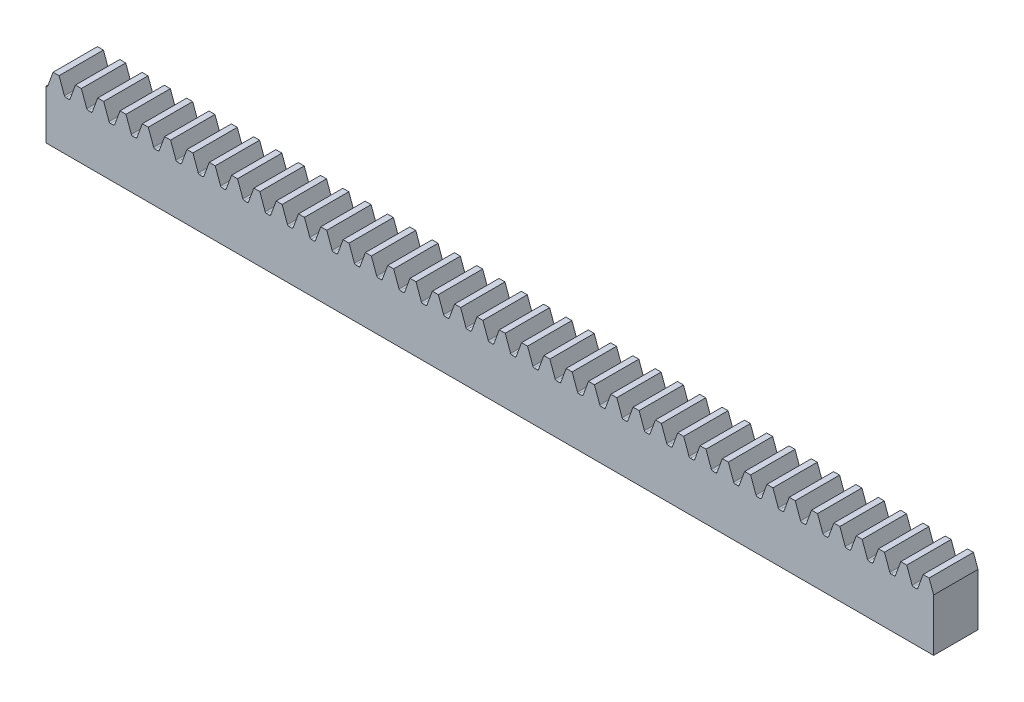
from build123d import *

# Parameters (mm, degrees)
BOSS_EXTRUDE1_DEPTH      = 125
BOSS_EXTRUDE1_DEPTH_BACK = 125
SKETCH3_W                = 5
SKETCH3_H                = 7.3
CUT_EXTRUDE1_DEPTH       = 126.078265498
FILLET1_R                = 0.167343945
LPATTERN1_START          = -2.5
LPATTERN1_DEPTH          = 5
SKETCH7_W                = 5
SKETCH7_H                = 7.3
CUT_EXTRUDE2_DEPTH       = 150


# Read off the part's stored shape, not the designer's step: LPattern1
with BuildPart() as part:
    # Sketch3 → Boss-Extrude1 (new, two sides: drawn at the far end of the back side and taken through both)
    with BuildSketch(Plane(origin=(0, 0, 0), x_dir=(0, 0, -1), z_dir=(1, 0, 0)).offset(-BOSS_EXTRUDE1_DEPTH_BACK)):
        Rectangle(SKETCH3_W, SKETCH3_H)
    extrude(amount=BOSS_EXTRUDE1_DEPTH + BOSS_EXTRUDE1_DEPTH_BACK)

    # Sketch4 → Cut-Extrude1 (cut, symmetric)
    with BuildSketch(Plane.XY):
        Polygon((-124.325716375, 3.65), (-123.685128763, 1.89), (-123.127315612, 1.89), (-122.486728, 3.65), align=None)
    extrude(amount=CUT_EXTRUDE1_DEPTH, both=True, mode=Mode.SUBTRACT)

    # Fillet1
    fillet1_edges = [part.edges().sort_by_distance(p)[0] for p in [
        (-123.127315612, 1.89, 0),
        (-123.685128763, 1.89, 0),
    ]]
    fillet(fillet1_edges, radius=FILLET1_R)

    # LPattern1 outline → LPattern1 (cut)
    with BuildSketch(Plane.XY.offset(LPATTERN1_START)):
        with BuildLine():
            ThreePointArc((-121.211933141, 2.000108945), (-121.150665815, 1.92026381), (-121.054681271, 1.89))
            Line((-121.054681271, 1.89), (-120.731219104, 1.89))
            ThreePointArc((-120.731219104, 1.89), (-120.63523456, 1.92026381), (-120.573967234, 2.000108945))
            Line((-120.573967234, 2.000108945), (-119.973456, 3.65))
            Line((-119.973456, 3.65), (-121.812444375, 3.65))
            Line((-121.812444375, 3.65), (-121.211933141, 2.000108945))
        make_face()
        Polygon((125, 3.65), (124.488211625, 3.65), (125, 2.243872997), align=None)
        with BuildLine():
            Line((123.813928, 3.65), (121.974939625, 3.65))
            Line((121.974939625, 3.65), (122.575450859, 2.000108945))
            ThreePointArc((122.575450859, 2.000108945), (122.636718185, 1.92026381), (122.732702729, 1.89))
            Line((122.732702729, 1.89), (123.056164896, 1.89))
            ThreePointArc((123.056164896, 1.89), (123.15214944, 1.92026381), (123.213416766, 2.000108945))
            Line((123.213416766, 2.000108945), (123.813928, 3.65))
        make_face()
        with BuildLine():
            Line((121.300656, 3.65), (119.461667625, 3.65))
            Line((119.461667625, 3.65), (120.062178859, 2.000108945))
            ThreePointArc((120.062178859, 2.000108945), (120.123446185, 1.92026381), (120.219430729, 1.89))
            Line((120.219430729, 1.89), (120.542892896, 1.89))
            ThreePointArc((120.542892896, 1.89), (120.63887744, 1.92026381), (120.700144766, 2.000108945))
            Line((120.700144766, 2.000108945), (121.300656, 3.65))
        make_face()
        with BuildLine():
            Line((118.787384, 3.65), (116.948395625, 3.65))
            Line((116.948395625, 3.65), (117.548906859, 2.000108945))
            ThreePointArc((117.548906859, 2.000108945), (117.610174185, 1.92026381), (117.706158729, 1.89))
            Line((117.706158729, 1.89), (118.029620896, 1.89))
            ThreePointArc((118.029620896, 1.89), (118.12560544, 1.92026381), (118.186872766, 2.000108945))
            Line((118.186872766, 2.000108945), (118.787384, 3.65))
        make_face()
        with BuildLine():
            Line((116.274112, 3.65), (114.435123625, 3.65))
            Line((114.435123625, 3.65), (115.035634859, 2.000108945))
            ThreePointArc((115.035634859, 2.000108945), (115.096902185, 1.92026381), (115.192886729, 1.89))
            Line((115.192886729, 1.89), (115.516348896, 1.89))
            ThreePointArc((115.516348896, 1.89), (115.61233344, 1.92026381), (115.673600766, 2.000108945))
            Line((115.673600766, 2.000108945), (116.274112, 3.65))
        make_face()
        with BuildLine():
            Line((113.76084, 3.65), (111.921851625, 3.65))
            Line((111.921851625, 3.65), (112.522362859, 2.000108945))
            ThreePointArc((112.522362859, 2.000108945), (112.583630185, 1.92026381), (112.679614729, 1.89))
            Line((112.679614729, 1.89), (113.003076896, 1.89))
            ThreePointArc((113.003076896, 1.89), (113.09906144, 1.92026381), (113.160328766, 2.000108945))
            Line((113.160328766, 2.000108945), (113.76084, 3.65))
        make_face()
        with BuildLine():
            Line((111.247568, 3.65), (109.408579625, 3.65))
            Line((109.408579625, 3.65), (110.009090859, 2.000108945))
            ThreePointArc((110.009090859, 2.000108945), (110.070358185, 1.92026381), (110.166342729, 1.89))
            Line((110.166342729, 1.89), (110.489804896, 1.89))
            ThreePointArc((110.489804896, 1.89), (110.58578944, 1.92026381), (110.647056766, 2.000108945))
            Line((110.647056766, 2.000108945), (111.247568, 3.65))
        make_face()
        with BuildLine():
            Line((108.734296, 3.65), (106.895307625, 3.65))
            Line((106.895307625, 3.65), (107.495818859, 2.000108945))
            ThreePointArc((107.495818859, 2.000108945), (107.557086185, 1.92026381), (107.653070729, 1.89))
            Line((107.653070729, 1.89), (107.976532896, 1.89))
            ThreePointArc((107.976532896, 1.89), (108.07251744, 1.92026381), (108.133784766, 2.000108945))
            Line((108.133784766, 2.000108945), (108.734296, 3.65))
        make_face()
        with BuildLine():
            Line((106.221024, 3.65), (104.382035625, 3.65))
            Line((104.382035625, 3.65), (104.982546859, 2.000108945))
            ThreePointArc((104.982546859, 2.000108945), (105.043814185, 1.92026381), (105.139798729, 1.89))
            Line((105.139798729, 1.89), (105.463260896, 1.89))
            ThreePointArc((105.463260896, 1.89), (105.55924544, 1.92026381), (105.620512766, 2.000108945))
            Line((105.620512766, 2.000108945), (106.221024, 3.65))
        make_face()
        with BuildLine():
            Line((103.707752, 3.65), (101.868763625, 3.65))
            Line((101.868763625, 3.65), (102.469274859, 2.000108945))
            ThreePointArc((102.469274859, 2.000108945), (102.530542185, 1.92026381), (102.626526729, 1.89))
            Line((102.626526729, 1.89), (102.949988896, 1.89))
            ThreePointArc((102.949988896, 1.89), (103.04597344, 1.92026381), (103.107240766, 2.000108945))
            Line((103.107240766, 2.000108945), (103.707752, 3.65))
        make_face()
        with BuildLine():
            Line((101.19448, 3.65), (99.355491625, 3.65))
            Line((99.355491625, 3.65), (99.956002859, 2.000108945))
            ThreePointArc((99.956002859, 2.000108945), (100.017270185, 1.92026381), (100.113254729, 1.89))
            Line((100.113254729, 1.89), (100.436716896, 1.89))
            ThreePointArc((100.436716896, 1.89), (100.53270144, 1.92026381), (100.593968766, 2.000108945))
            Line((100.593968766, 2.000108945), (101.19448, 3.65))
        make_face()
        with BuildLine():
            Line((98.681208, 3.65), (96.842219625, 3.65))
            Line((96.842219625, 3.65), (97.442730859, 2.000108945))
            ThreePointArc((97.442730859, 2.000108945), (97.503998185, 1.92026381), (97.599982729, 1.89))
            Line((97.599982729, 1.89), (97.923444896, 1.89))
            ThreePointArc((97.923444896, 1.89), (98.01942944, 1.92026381), (98.080696766, 2.000108945))
            Line((98.080696766, 2.000108945), (98.681208, 3.65))
        make_face()
        with BuildLine():
            Line((96.167936, 3.65), (94.328947625, 3.65))
            Line((94.328947625, 3.65), (94.929458859, 2.000108945))
            ThreePointArc((94.929458859, 2.000108945), (94.990726185, 1.92026381), (95.086710729, 1.89))
            Line((95.086710729, 1.89), (95.410172896, 1.89))
            ThreePointArc((95.410172896, 1.89), (95.50615744, 1.92026381), (95.567424766, 2.000108945))
            Line((95.567424766, 2.000108945), (96.167936, 3.65))
        make_face()
        with BuildLine():
            Line((93.654664, 3.65), (91.815675625, 3.65))
            Line((91.815675625, 3.65), (92.416186859, 2.000108945))
            ThreePointArc((92.416186859, 2.000108945), (92.477454185, 1.92026381), (92.573438729, 1.89))
            Line((92.573438729, 1.89), (92.896900896, 1.89))
            ThreePointArc((92.896900896, 1.89), (92.99288544, 1.92026381), (93.054152766, 2.000108945))
            Line((93.054152766, 2.000108945), (93.654664, 3.65))
        make_face()
        with BuildLine():
            Line((91.141392, 3.65), (89.302403625, 3.65))
            Line((89.302403625, 3.65), (89.902914859, 2.000108945))
            ThreePointArc((89.902914859, 2.000108945), (89.964182185, 1.92026381), (90.060166729, 1.89))
            Line((90.060166729, 1.89), (90.383628896, 1.89))
            ThreePointArc((90.383628896, 1.89), (90.47961344, 1.92026381), (90.540880766, 2.000108945))
            Line((90.540880766, 2.000108945), (91.141392, 3.65))
        make_face()
        with BuildLine():
            Line((88.62812, 3.65), (86.789131625, 3.65))
            Line((86.789131625, 3.65), (87.389642859, 2.000108945))
            ThreePointArc((87.389642859, 2.000108945), (87.450910185, 1.92026381), (87.546894729, 1.89))
            Line((87.546894729, 1.89), (87.870356896, 1.89))
            ThreePointArc((87.870356896, 1.89), (87.96634144, 1.92026381), (88.027608766, 2.000108945))
            Line((88.027608766, 2.000108945), (88.62812, 3.65))
        make_face()
        with BuildLine():
            Line((86.114848, 3.65), (84.275859625, 3.65))
            Line((84.275859625, 3.65), (84.876370859, 2.000108945))
            ThreePointArc((84.876370859, 2.000108945), (84.937638185, 1.92026381), (85.033622729, 1.89))
            Line((85.033622729, 1.89), (85.357084896, 1.89))
            ThreePointArc((85.357084896, 1.89), (85.45306944, 1.92026381), (85.514336766, 2.000108945))
            Line((85.514336766, 2.000108945), (86.114848, 3.65))
        make_face()
        with BuildLine():
            Line((83.601576, 3.65), (81.762587625, 3.65))
            Line((81.762587625, 3.65), (82.363098859, 2.000108945))
            ThreePointArc((82.363098859, 2.000108945), (82.424366185, 1.92026381), (82.520350729, 1.89))
            Line((82.520350729, 1.89), (82.843812896, 1.89))
            ThreePointArc((82.843812896, 1.89), (82.93979744, 1.92026381), (83.001064766, 2.000108945))
            Line((83.001064766, 2.000108945), (83.601576, 3.65))
        make_face()
        with BuildLine():
            Line((81.088304, 3.65), (79.249315625, 3.65))
            Line((79.249315625, 3.65), (79.849826859, 2.000108945))
            ThreePointArc((79.849826859, 2.000108945), (79.911094185, 1.92026381), (80.007078729, 1.89))
            Line((80.007078729, 1.89), (80.330540896, 1.89))
            ThreePointArc((80.330540896, 1.89), (80.42652544, 1.92026381), (80.487792766, 2.000108945))
            Line((80.487792766, 2.000108945), (81.088304, 3.65))
        make_face()
        with BuildLine():
            Line((78.575032, 3.65), (76.736043625, 3.65))
            Line((76.736043625, 3.65), (77.336554859, 2.000108945))
            ThreePointArc((77.336554859, 2.000108945), (77.397822185, 1.92026381), (77.493806729, 1.89))
            Line((77.493806729, 1.89), (77.817268896, 1.89))
            ThreePointArc((77.817268896, 1.89), (77.91325344, 1.92026381), (77.974520766, 2.000108945))
            Line((77.974520766, 2.000108945), (78.575032, 3.65))
        make_face()
        with BuildLine():
            Line((76.06176, 3.65), (74.222771625, 3.65))
            Line((74.222771625, 3.65), (74.823282859, 2.000108945))
            ThreePointArc((74.823282859, 2.000108945), (74.884550185, 1.92026381), (74.980534729, 1.89))
            Line((74.980534729, 1.89), (75.303996896, 1.89))
            ThreePointArc((75.303996896, 1.89), (75.39998144, 1.92026381), (75.461248766, 2.000108945))
            Line((75.461248766, 2.000108945), (76.06176, 3.65))
        make_face()
        with BuildLine():
            Line((73.548488, 3.65), (71.709499625, 3.65))
            Line((71.709499625, 3.65), (72.310010859, 2.000108945))
            ThreePointArc((72.310010859, 2.000108945), (72.371278185, 1.92026381), (72.467262729, 1.89))
            Line((72.467262729, 1.89), (72.790724896, 1.89))
            ThreePointArc((72.790724896, 1.89), (72.88670944, 1.92026381), (72.947976766, 2.000108945))
            Line((72.947976766, 2.000108945), (73.548488, 3.65))
        make_face()
        with BuildLine():
            Line((71.035216, 3.65), (69.196227625, 3.65))
            Line((69.196227625, 3.65), (69.796738859, 2.000108945))
            ThreePointArc((69.796738859, 2.000108945), (69.858006185, 1.92026381), (69.953990729, 1.89))
            Line((69.953990729, 1.89), (70.277452896, 1.89))
            ThreePointArc((70.277452896, 1.89), (70.37343744, 1.92026381), (70.434704766, 2.000108945))
            Line((70.434704766, 2.000108945), (71.035216, 3.65))
        make_face()
        with BuildLine():
            Line((68.521944, 3.65), (66.682955625, 3.65))
            Line((66.682955625, 3.65), (67.283466859, 2.000108945))
            ThreePointArc((67.283466859, 2.000108945), (67.344734185, 1.92026381), (67.440718729, 1.89))
            Line((67.440718729, 1.89), (67.764180896, 1.89))
            ThreePointArc((67.764180896, 1.89), (67.86016544, 1.92026381), (67.921432766, 2.000108945))
            Line((67.921432766, 2.000108945), (68.521944, 3.65))
        make_face()
        with BuildLine():
            Line((66.008672, 3.65), (64.169683625, 3.65))
            Line((64.169683625, 3.65), (64.770194859, 2.000108945))
            ThreePointArc((64.770194859, 2.000108945), (64.831462185, 1.92026381), (64.927446729, 1.89))
            Line((64.927446729, 1.89), (65.250908896, 1.89))
            ThreePointArc((65.250908896, 1.89), (65.34689344, 1.92026381), (65.408160766, 2.000108945))
            Line((65.408160766, 2.000108945), (66.008672, 3.65))
        make_face()
        with BuildLine():
            Line((63.4954, 3.65), (61.656411625, 3.65))
            Line((61.656411625, 3.65), (62.256922859, 2.000108945))
            ThreePointArc((62.256922859, 2.000108945), (62.318190185, 1.92026381), (62.414174729, 1.89))
            Line((62.414174729, 1.89), (62.737636896, 1.89))
            ThreePointArc((62.737636896, 1.89), (62.83362144, 1.92026381), (62.894888766, 2.000108945))
            Line((62.894888766, 2.000108945), (63.4954, 3.65))
        make_face()
        with BuildLine():
            Line((60.982128, 3.65), (59.143139625, 3.65))
            Line((59.143139625, 3.65), (59.743650859, 2.000108945))
            ThreePointArc((59.743650859, 2.000108945), (59.804918185, 1.92026381), (59.900902729, 1.89))
            Line((59.900902729, 1.89), (60.224364896, 1.89))
            ThreePointArc((60.224364896, 1.89), (60.32034944, 1.92026381), (60.381616766, 2.000108945))
            Line((60.381616766, 2.000108945), (60.982128, 3.65))
        make_face()
        with BuildLine():
            Line((58.468856, 3.65), (56.629867625, 3.65))
            Line((56.629867625, 3.65), (57.230378859, 2.000108945))
            ThreePointArc((57.230378859, 2.000108945), (57.291646185, 1.92026381), (57.387630729, 1.89))
            Line((57.387630729, 1.89), (57.711092896, 1.89))
            ThreePointArc((57.711092896, 1.89), (57.80707744, 1.92026381), (57.868344766, 2.000108945))
            Line((57.868344766, 2.000108945), (58.468856, 3.65))
        make_face()
        with BuildLine():
            Line((55.955584, 3.65), (54.116595625, 3.65))
            Line((54.116595625, 3.65), (54.717106859, 2.000108945))
            ThreePointArc((54.717106859, 2.000108945), (54.778374185, 1.92026381), (54.874358729, 1.89))
            Line((54.874358729, 1.89), (55.197820896, 1.89))
            ThreePointArc((55.197820896, 1.89), (55.29380544, 1.92026381), (55.355072766, 2.000108945))
            Line((55.355072766, 2.000108945), (55.955584, 3.65))
        make_face()
        with BuildLine():
            Line((53.442312, 3.65), (51.603323625, 3.65))
            Line((51.603323625, 3.65), (52.203834859, 2.000108945))
            ThreePointArc((52.203834859, 2.000108945), (52.265102185, 1.92026381), (52.361086729, 1.89))
            Line((52.361086729, 1.89), (52.684548896, 1.89))
            ThreePointArc((52.684548896, 1.89), (52.78053344, 1.92026381), (52.841800766, 2.000108945))
            Line((52.841800766, 2.000108945), (53.442312, 3.65))
        make_face()
        with BuildLine():
            Line((50.92904, 3.65), (49.090051625, 3.65))
            Line((49.090051625, 3.65), (49.690562859, 2.000108945))
            ThreePointArc((49.690562859, 2.000108945), (49.751830185, 1.92026381), (49.847814729, 1.89))
            Line((49.847814729, 1.89), (50.171276896, 1.89))
            ThreePointArc((50.171276896, 1.89), (50.26726144, 1.92026381), (50.328528766, 2.000108945))
            Line((50.328528766, 2.000108945), (50.92904, 3.65))
        make_face()
        with BuildLine():
            Line((48.415768, 3.65), (46.576779625, 3.65))
            Line((46.576779625, 3.65), (47.177290859, 2.000108945))
            ThreePointArc((47.177290859, 2.000108945), (47.238558185, 1.92026381), (47.334542729, 1.89))
            Line((47.334542729, 1.89), (47.658004896, 1.89))
            ThreePointArc((47.658004896, 1.89), (47.75398944, 1.92026381), (47.815256766, 2.000108945))
            Line((47.815256766, 2.000108945), (48.415768, 3.65))
        make_face()
        with BuildLine():
            Line((45.902496, 3.65), (44.063507625, 3.65))
            Line((44.063507625, 3.65), (44.664018859, 2.000108945))
            ThreePointArc((44.664018859, 2.000108945), (44.725286185, 1.92026381), (44.821270729, 1.89))
            Line((44.821270729, 1.89), (45.144732896, 1.89))
            ThreePointArc((45.144732896, 1.89), (45.24071744, 1.92026381), (45.301984766, 2.000108945))
            Line((45.301984766, 2.000108945), (45.902496, 3.65))
        make_face()
        with BuildLine():
            Line((43.389224, 3.65), (41.550235625, 3.65))
            Line((41.550235625, 3.65), (42.150746859, 2.000108945))
            ThreePointArc((42.150746859, 2.000108945), (42.212014185, 1.92026381), (42.307998729, 1.89))
            Line((42.307998729, 1.89), (42.631460896, 1.89))
            ThreePointArc((42.631460896, 1.89), (42.72744544, 1.92026381), (42.788712766, 2.000108945))
            Line((42.788712766, 2.000108945), (43.389224, 3.65))
        make_face()
        with BuildLine():
            Line((40.875952, 3.65), (39.036963625, 3.65))
            Line((39.036963625, 3.65), (39.637474859, 2.000108945))
            ThreePointArc((39.637474859, 2.000108945), (39.698742185, 1.92026381), (39.794726729, 1.89))
            Line((39.794726729, 1.89), (40.118188896, 1.89))
            ThreePointArc((40.118188896, 1.89), (40.21417344, 1.92026381), (40.275440766, 2.000108945))
            Line((40.275440766, 2.000108945), (40.875952, 3.65))
        make_face()
        with BuildLine():
            Line((38.36268, 3.65), (36.523691625, 3.65))
            Line((36.523691625, 3.65), (37.124202859, 2.000108945))
            ThreePointArc((37.124202859, 2.000108945), (37.185470185, 1.92026381), (37.281454729, 1.89))
            Line((37.281454729, 1.89), (37.604916896, 1.89))
            ThreePointArc((37.604916896, 1.89), (37.70090144, 1.92026381), (37.762168766, 2.000108945))
            Line((37.762168766, 2.000108945), (38.36268, 3.65))
        make_face()
        with BuildLine():
            Line((35.849408, 3.65), (34.010419625, 3.65))
            Line((34.010419625, 3.65), (34.610930859, 2.000108945))
            ThreePointArc((34.610930859, 2.000108945), (34.672198185, 1.92026381), (34.768182729, 1.89))
            Line((34.768182729, 1.89), (35.091644896, 1.89))
            ThreePointArc((35.091644896, 1.89), (35.18762944, 1.92026381), (35.248896766, 2.000108945))
            Line((35.248896766, 2.000108945), (35.849408, 3.65))
        make_face()
        with BuildLine():
            Line((33.336136, 3.65), (31.497147625, 3.65))
            Line((31.497147625, 3.65), (32.097658859, 2.000108945))
            ThreePointArc((32.097658859, 2.000108945), (32.158926185, 1.92026381), (32.254910729, 1.89))
            Line((32.254910729, 1.89), (32.578372896, 1.89))
            ThreePointArc((32.578372896, 1.89), (32.67435744, 1.92026381), (32.735624766, 2.000108945))
            Line((32.735624766, 2.000108945), (33.336136, 3.65))
        make_face()
        with BuildLine():
            Line((30.822864, 3.65), (28.983875625, 3.65))
            Line((28.983875625, 3.65), (29.584386859, 2.000108945))
            ThreePointArc((29.584386859, 2.000108945), (29.645654185, 1.92026381), (29.741638729, 1.89))
            Line((29.741638729, 1.89), (30.065100896, 1.89))
            ThreePointArc((30.065100896, 1.89), (30.16108544, 1.92026381), (30.222352766, 2.000108945))
            Line((30.222352766, 2.000108945), (30.822864, 3.65))
        make_face()
        with BuildLine():
            Line((28.309592, 3.65), (26.470603625, 3.65))
            Line((26.470603625, 3.65), (27.071114859, 2.000108945))
            ThreePointArc((27.071114859, 2.000108945), (27.132382185, 1.92026381), (27.228366729, 1.89))
            Line((27.228366729, 1.89), (27.551828896, 1.89))
            ThreePointArc((27.551828896, 1.89), (27.64781344, 1.92026381), (27.709080766, 2.000108945))
            Line((27.709080766, 2.000108945), (28.309592, 3.65))
        make_face()
        with BuildLine():
            Line((25.79632, 3.65), (23.957331625, 3.65))
            Line((23.957331625, 3.65), (24.557842859, 2.000108945))
            ThreePointArc((24.557842859, 2.000108945), (24.619110185, 1.92026381), (24.715094729, 1.89))
            Line((24.715094729, 1.89), (25.038556896, 1.89))
            ThreePointArc((25.038556896, 1.89), (25.13454144, 1.92026381), (25.195808766, 2.000108945))
            Line((25.195808766, 2.000108945), (25.79632, 3.65))
        make_face()
        with BuildLine():
            Line((23.283048, 3.65), (21.444059625, 3.65))
            Line((21.444059625, 3.65), (22.044570859, 2.000108945))
            ThreePointArc((22.044570859, 2.000108945), (22.105838185, 1.92026381), (22.201822729, 1.89))
            Line((22.201822729, 1.89), (22.525284896, 1.89))
            ThreePointArc((22.525284896, 1.89), (22.62126944, 1.92026381), (22.682536766, 2.000108945))
            Line((22.682536766, 2.000108945), (23.283048, 3.65))
        make_face()
        with BuildLine():
            Line((20.769776, 3.65), (18.930787625, 3.65))
            Line((18.930787625, 3.65), (19.531298859, 2.000108945))
            ThreePointArc((19.531298859, 2.000108945), (19.592566185, 1.92026381), (19.688550729, 1.89))
            Line((19.688550729, 1.89), (20.012012896, 1.89))
            ThreePointArc((20.012012896, 1.89), (20.10799744, 1.92026381), (20.169264766, 2.000108945))
            Line((20.169264766, 2.000108945), (20.769776, 3.65))
        make_face()
        with BuildLine():
            Line((18.256504, 3.65), (16.417515625, 3.65))
            Line((16.417515625, 3.65), (17.018026859, 2.000108945))
            ThreePointArc((17.018026859, 2.000108945), (17.079294185, 1.92026381), (17.175278729, 1.89))
            Line((17.175278729, 1.89), (17.498740896, 1.89))
            ThreePointArc((17.498740896, 1.89), (17.59472544, 1.92026381), (17.655992766, 2.000108945))
            Line((17.655992766, 2.000108945), (18.256504, 3.65))
        make_face()
        with BuildLine():
            Line((15.743232, 3.65), (13.904243625, 3.65))
            Line((13.904243625, 3.65), (14.504754859, 2.000108945))
            ThreePointArc((14.504754859, 2.000108945), (14.566022185, 1.92026381), (14.662006729, 1.89))
            Line((14.662006729, 1.89), (14.985468896, 1.89))
            ThreePointArc((14.985468896, 1.89), (15.08145344, 1.92026381), (15.142720766, 2.000108945))
            Line((15.142720766, 2.000108945), (15.743232, 3.65))
        make_face()
        with BuildLine():
            Line((13.22996, 3.65), (11.390971625, 3.65))
            Line((11.390971625, 3.65), (11.991482859, 2.000108945))
            ThreePointArc((11.991482859, 2.000108945), (12.052750185, 1.92026381), (12.148734729, 1.89))
            Line((12.148734729, 1.89), (12.472196896, 1.89))
            ThreePointArc((12.472196896, 1.89), (12.56818144, 1.92026381), (12.629448766, 2.000108945))
            Line((12.629448766, 2.000108945), (13.22996, 3.65))
        make_face()
        with BuildLine():
            Line((10.716688, 3.65), (8.877699625, 3.65))
            Line((8.877699625, 3.65), (9.478210859, 2.000108945))
            ThreePointArc((9.478210859, 2.000108945), (9.539478185, 1.92026381), (9.635462729, 1.89))
            Line((9.635462729, 1.89), (9.958924896, 1.89))
            ThreePointArc((9.958924896, 1.89), (10.05490944, 1.92026381), (10.116176766, 2.000108945))
            Line((10.116176766, 2.000108945), (10.716688, 3.65))
        make_face()
        with BuildLine():
            Line((8.203416, 3.65), (6.364427625, 3.65))
            Line((6.364427625, 3.65), (6.964938859, 2.000108945))
            ThreePointArc((6.964938859, 2.000108945), (7.026206185, 1.92026381), (7.122190729, 1.89))
            Line((7.122190729, 1.89), (7.445652896, 1.89))
            ThreePointArc((7.445652896, 1.89), (7.54163744, 1.92026381), (7.602904766, 2.000108945))
            Line((7.602904766, 2.000108945), (8.203416, 3.65))
        make_face()
        with BuildLine():
            Line((5.690144, 3.65), (3.851155625, 3.65))
            Line((3.851155625, 3.65), (4.451666859, 2.000108945))
            ThreePointArc((4.451666859, 2.000108945), (4.512934185, 1.92026381), (4.608918729, 1.89))
            Line((4.608918729, 1.89), (4.932380896, 1.89))
            ThreePointArc((4.932380896, 1.89), (5.02836544, 1.92026381), (5.089632766, 2.000108945))
            Line((5.089632766, 2.000108945), (5.690144, 3.65))
        make_face()
        with BuildLine():
            Line((3.176872, 3.65), (1.337883625, 3.65))
            Line((1.337883625, 3.65), (1.938394859, 2.000108945))
            ThreePointArc((1.938394859, 2.000108945), (1.999662185, 1.92026381), (2.095646729, 1.89))
            Line((2.095646729, 1.89), (2.419108896, 1.89))
            ThreePointArc((2.419108896, 1.89), (2.51509344, 1.92026381), (2.576360766, 2.000108945))
            Line((2.576360766, 2.000108945), (3.176872, 3.65))
        make_face()
        with BuildLine():
            Line((0.6636, 3.65), (-1.175388375, 3.65))
            Line((-1.175388375, 3.65), (-0.574877141, 2.000108945))
            ThreePointArc((-0.574877141, 2.000108945), (-0.513609815, 1.92026381), (-0.417625271, 1.89))
            Line((-0.417625271, 1.89), (-0.094163104, 1.89))
            ThreePointArc((-0.094163104, 1.89), (0.00182144, 1.92026381), (0.063088766, 2.000108945))
            Line((0.063088766, 2.000108945), (0.6636, 3.65))
        make_face()
        with BuildLine():
            Line((-1.849672, 3.65), (-3.688660375, 3.65))
            Line((-3.688660375, 3.65), (-3.088149141, 2.000108945))
            ThreePointArc((-3.088149141, 2.000108945), (-3.026881815, 1.92026381), (-2.930897271, 1.89))
            Line((-2.930897271, 1.89), (-2.607435104, 1.89))
            ThreePointArc((-2.607435104, 1.89), (-2.51145056, 1.92026381), (-2.450183234, 2.000108945))
            Line((-2.450183234, 2.000108945), (-1.849672, 3.65))
        make_face()
        with BuildLine():
            Line((-4.362944, 3.65), (-6.201932375, 3.65))
            Line((-6.201932375, 3.65), (-5.601421141, 2.000108945))
            ThreePointArc((-5.601421141, 2.000108945), (-5.540153815, 1.92026381), (-5.444169271, 1.89))
            Line((-5.444169271, 1.89), (-5.120707104, 1.89))
            ThreePointArc((-5.120707104, 1.89), (-5.02472256, 1.92026381), (-4.963455234, 2.000108945))
            Line((-4.963455234, 2.000108945), (-4.362944, 3.65))
        make_face()
        with BuildLine():
            Line((-6.876216, 3.65), (-8.715204375, 3.65))
            Line((-8.715204375, 3.65), (-8.114693141, 2.000108945))
            ThreePointArc((-8.114693141, 2.000108945), (-8.053425815, 1.92026381), (-7.957441271, 1.89))
            Line((-7.957441271, 1.89), (-7.633979104, 1.89))
            ThreePointArc((-7.633979104, 1.89), (-7.53799456, 1.92026381), (-7.476727234, 2.000108945))
            Line((-7.476727234, 2.000108945), (-6.876216, 3.65))
        make_face()
        with BuildLine():
            Line((-9.389488, 3.65), (-11.228476375, 3.65))
            Line((-11.228476375, 3.65), (-10.627965141, 2.000108945))
            ThreePointArc((-10.627965141, 2.000108945), (-10.566697815, 1.92026381), (-10.470713271, 1.89))
            Line((-10.470713271, 1.89), (-10.147251104, 1.89))
            ThreePointArc((-10.147251104, 1.89), (-10.05126656, 1.92026381), (-9.989999234, 2.000108945))
            Line((-9.989999234, 2.000108945), (-9.389488, 3.65))
        make_face()
        with BuildLine():
            Line((-11.90276, 3.65), (-13.741748375, 3.65))
            Line((-13.741748375, 3.65), (-13.141237141, 2.000108945))
            ThreePointArc((-13.141237141, 2.000108945), (-13.079969815, 1.92026381), (-12.983985271, 1.89))
            Line((-12.983985271, 1.89), (-12.660523104, 1.89))
            ThreePointArc((-12.660523104, 1.89), (-12.56453856, 1.92026381), (-12.503271234, 2.000108945))
            Line((-12.503271234, 2.000108945), (-11.90276, 3.65))
        make_face()
        with BuildLine():
            Line((-14.416032, 3.65), (-16.255020375, 3.65))
            Line((-16.255020375, 3.65), (-15.654509141, 2.000108945))
            ThreePointArc((-15.654509141, 2.000108945), (-15.593241815, 1.92026381), (-15.497257271, 1.89))
            Line((-15.497257271, 1.89), (-15.173795104, 1.89))
            ThreePointArc((-15.173795104, 1.89), (-15.07781056, 1.92026381), (-15.016543234, 2.000108945))
            Line((-15.016543234, 2.000108945), (-14.416032, 3.65))
        make_face()
        with BuildLine():
            Line((-16.929304, 3.65), (-18.768292375, 3.65))
            Line((-18.768292375, 3.65), (-18.167781141, 2.000108945))
            ThreePointArc((-18.167781141, 2.000108945), (-18.106513815, 1.92026381), (-18.010529271, 1.89))
            Line((-18.010529271, 1.89), (-17.687067104, 1.89))
            ThreePointArc((-17.687067104, 1.89), (-17.59108256, 1.92026381), (-17.529815234, 2.000108945))
            Line((-17.529815234, 2.000108945), (-16.929304, 3.65))
        make_face()
        with BuildLine():
            Line((-19.442576, 3.65), (-21.281564375, 3.65))
            Line((-21.281564375, 3.65), (-20.681053141, 2.000108945))
            ThreePointArc((-20.681053141, 2.000108945), (-20.619785815, 1.92026381), (-20.523801271, 1.89))
            Line((-20.523801271, 1.89), (-20.200339104, 1.89))
            ThreePointArc((-20.200339104, 1.89), (-20.10435456, 1.92026381), (-20.043087234, 2.000108945))
            Line((-20.043087234, 2.000108945), (-19.442576, 3.65))
        make_face()
        with BuildLine():
            Line((-21.955848, 3.65), (-23.794836375, 3.65))
            Line((-23.794836375, 3.65), (-23.194325141, 2.000108945))
            ThreePointArc((-23.194325141, 2.000108945), (-23.133057815, 1.92026381), (-23.037073271, 1.89))
            Line((-23.037073271, 1.89), (-22.713611104, 1.89))
            ThreePointArc((-22.713611104, 1.89), (-22.61762656, 1.92026381), (-22.556359234, 2.000108945))
            Line((-22.556359234, 2.000108945), (-21.955848, 3.65))
        make_face()
        with BuildLine():
            Line((-24.46912, 3.65), (-26.308108375, 3.65))
            Line((-26.308108375, 3.65), (-25.707597141, 2.000108945))
            ThreePointArc((-25.707597141, 2.000108945), (-25.646329815, 1.92026381), (-25.550345271, 1.89))
            Line((-25.550345271, 1.89), (-25.226883104, 1.89))
            ThreePointArc((-25.226883104, 1.89), (-25.13089856, 1.92026381), (-25.069631234, 2.000108945))
            Line((-25.069631234, 2.000108945), (-24.46912, 3.65))
        make_face()
        with BuildLine():
            Line((-26.982392, 3.65), (-28.821380375, 3.65))
            Line((-28.821380375, 3.65), (-28.220869141, 2.000108945))
            ThreePointArc((-28.220869141, 2.000108945), (-28.159601815, 1.92026381), (-28.063617271, 1.89))
            Line((-28.063617271, 1.89), (-27.740155104, 1.89))
            ThreePointArc((-27.740155104, 1.89), (-27.64417056, 1.92026381), (-27.582903234, 2.000108945))
            Line((-27.582903234, 2.000108945), (-26.982392, 3.65))
        make_face()
        with BuildLine():
            Line((-29.495664, 3.65), (-31.334652375, 3.65))
            Line((-31.334652375, 3.65), (-30.734141141, 2.000108945))
            ThreePointArc((-30.734141141, 2.000108945), (-30.672873815, 1.92026381), (-30.576889271, 1.89))
            Line((-30.576889271, 1.89), (-30.253427104, 1.89))
            ThreePointArc((-30.253427104, 1.89), (-30.15744256, 1.92026381), (-30.096175234, 2.000108945))
            Line((-30.096175234, 2.000108945), (-29.495664, 3.65))
        make_face()
        with BuildLine():
            Line((-32.008936, 3.65), (-33.847924375, 3.65))
            Line((-33.847924375, 3.65), (-33.247413141, 2.000108945))
            ThreePointArc((-33.247413141, 2.000108945), (-33.186145815, 1.92026381), (-33.090161271, 1.89))
            Line((-33.090161271, 1.89), (-32.766699104, 1.89))
            ThreePointArc((-32.766699104, 1.89), (-32.67071456, 1.92026381), (-32.609447234, 2.000108945))
            Line((-32.609447234, 2.000108945), (-32.008936, 3.65))
        make_face()
        with BuildLine():
            Line((-34.522208, 3.65), (-36.361196375, 3.65))
            Line((-36.361196375, 3.65), (-35.760685141, 2.000108945))
            ThreePointArc((-35.760685141, 2.000108945), (-35.699417815, 1.92026381), (-35.603433271, 1.89))
            Line((-35.603433271, 1.89), (-35.279971104, 1.89))
            ThreePointArc((-35.279971104, 1.89), (-35.18398656, 1.92026381), (-35.122719234, 2.000108945))
            Line((-35.122719234, 2.000108945), (-34.522208, 3.65))
        make_face()
        with BuildLine():
            Line((-37.03548, 3.65), (-38.874468375, 3.65))
            Line((-38.874468375, 3.65), (-38.273957141, 2.000108945))
            ThreePointArc((-38.273957141, 2.000108945), (-38.212689815, 1.92026381), (-38.116705271, 1.89))
            Line((-38.116705271, 1.89), (-37.793243104, 1.89))
            ThreePointArc((-37.793243104, 1.89), (-37.69725856, 1.92026381), (-37.635991234, 2.000108945))
            Line((-37.635991234, 2.000108945), (-37.03548, 3.65))
        make_face()
        with BuildLine():
            Line((-39.548752, 3.65), (-41.387740375, 3.65))
            Line((-41.387740375, 3.65), (-40.787229141, 2.000108945))
            ThreePointArc((-40.787229141, 2.000108945), (-40.725961815, 1.92026381), (-40.629977271, 1.89))
            Line((-40.629977271, 1.89), (-40.306515104, 1.89))
            ThreePointArc((-40.306515104, 1.89), (-40.21053056, 1.92026381), (-40.149263234, 2.000108945))
            Line((-40.149263234, 2.000108945), (-39.548752, 3.65))
        make_face()
        with BuildLine():
            Line((-42.062024, 3.65), (-43.901012375, 3.65))
            Line((-43.901012375, 3.65), (-43.300501141, 2.000108945))
            ThreePointArc((-43.300501141, 2.000108945), (-43.239233815, 1.92026381), (-43.143249271, 1.89))
            Line((-43.143249271, 1.89), (-42.819787104, 1.89))
            ThreePointArc((-42.819787104, 1.89), (-42.72380256, 1.92026381), (-42.662535234, 2.000108945))
            Line((-42.662535234, 2.000108945), (-42.062024, 3.65))
        make_face()
        with BuildLine():
            Line((-44.575296, 3.65), (-46.414284375, 3.65))
            Line((-46.414284375, 3.65), (-45.813773141, 2.000108945))
            ThreePointArc((-45.813773141, 2.000108945), (-45.752505815, 1.92026381), (-45.656521271, 1.89))
            Line((-45.656521271, 1.89), (-45.333059104, 1.89))
            ThreePointArc((-45.333059104, 1.89), (-45.23707456, 1.92026381), (-45.175807234, 2.000108945))
            Line((-45.175807234, 2.000108945), (-44.575296, 3.65))
        make_face()
        with BuildLine():
            Line((-47.088568, 3.65), (-48.927556375, 3.65))
            Line((-48.927556375, 3.65), (-48.327045141, 2.000108945))
            ThreePointArc((-48.327045141, 2.000108945), (-48.265777815, 1.92026381), (-48.169793271, 1.89))
            Line((-48.169793271, 1.89), (-47.846331104, 1.89))
            ThreePointArc((-47.846331104, 1.89), (-47.75034656, 1.92026381), (-47.689079234, 2.000108945))
            Line((-47.689079234, 2.000108945), (-47.088568, 3.65))
        make_face()
        with BuildLine():
            Line((-49.60184, 3.65), (-51.440828375, 3.65))
            Line((-51.440828375, 3.65), (-50.840317141, 2.000108945))
            ThreePointArc((-50.840317141, 2.000108945), (-50.779049815, 1.92026381), (-50.683065271, 1.89))
            Line((-50.683065271, 1.89), (-50.359603104, 1.89))
            ThreePointArc((-50.359603104, 1.89), (-50.26361856, 1.92026381), (-50.202351234, 2.000108945))
            Line((-50.202351234, 2.000108945), (-49.60184, 3.65))
        make_face()
        with BuildLine():
            Line((-52.115112, 3.65), (-53.954100375, 3.65))
            Line((-53.954100375, 3.65), (-53.353589141, 2.000108945))
            ThreePointArc((-53.353589141, 2.000108945), (-53.292321815, 1.92026381), (-53.196337271, 1.89))
            Line((-53.196337271, 1.89), (-52.872875104, 1.89))
            ThreePointArc((-52.872875104, 1.89), (-52.77689056, 1.92026381), (-52.715623234, 2.000108945))
            Line((-52.715623234, 2.000108945), (-52.115112, 3.65))
        make_face()
        with BuildLine():
            Line((-54.628384, 3.65), (-56.467372375, 3.65))
            Line((-56.467372375, 3.65), (-55.866861141, 2.000108945))
            ThreePointArc((-55.866861141, 2.000108945), (-55.805593815, 1.92026381), (-55.709609271, 1.89))
            Line((-55.709609271, 1.89), (-55.386147104, 1.89))
            ThreePointArc((-55.386147104, 1.89), (-55.29016256, 1.92026381), (-55.228895234, 2.000108945))
            Line((-55.228895234, 2.000108945), (-54.628384, 3.65))
        make_face()
        with BuildLine():
            Line((-57.141656, 3.65), (-58.980644375, 3.65))
            Line((-58.980644375, 3.65), (-58.380133141, 2.000108945))
            ThreePointArc((-58.380133141, 2.000108945), (-58.318865815, 1.92026381), (-58.222881271, 1.89))
            Line((-58.222881271, 1.89), (-57.899419104, 1.89))
            ThreePointArc((-57.899419104, 1.89), (-57.80343456, 1.92026381), (-57.742167234, 2.000108945))
            Line((-57.742167234, 2.000108945), (-57.141656, 3.65))
        make_face()
        with BuildLine():
            Line((-59.654928, 3.65), (-61.493916375, 3.65))
            Line((-61.493916375, 3.65), (-60.893405141, 2.000108945))
            ThreePointArc((-60.893405141, 2.000108945), (-60.832137815, 1.92026381), (-60.736153271, 1.89))
            Line((-60.736153271, 1.89), (-60.412691104, 1.89))
            ThreePointArc((-60.412691104, 1.89), (-60.31670656, 1.92026381), (-60.255439234, 2.000108945))
            Line((-60.255439234, 2.000108945), (-59.654928, 3.65))
        make_face()
        with BuildLine():
            Line((-62.1682, 3.65), (-64.007188375, 3.65))
            Line((-64.007188375, 3.65), (-63.406677141, 2.000108945))
            ThreePointArc((-63.406677141, 2.000108945), (-63.345409815, 1.92026381), (-63.249425271, 1.89))
            Line((-63.249425271, 1.89), (-62.925963104, 1.89))
            ThreePointArc((-62.925963104, 1.89), (-62.82997856, 1.92026381), (-62.768711234, 2.000108945))
            Line((-62.768711234, 2.000108945), (-62.1682, 3.65))
        make_face()
        with BuildLine():
            Line((-64.681472, 3.65), (-66.520460375, 3.65))
            Line((-66.520460375, 3.65), (-65.919949141, 2.000108945))
            ThreePointArc((-65.919949141, 2.000108945), (-65.858681815, 1.92026381), (-65.762697271, 1.89))
            Line((-65.762697271, 1.89), (-65.439235104, 1.89))
            ThreePointArc((-65.439235104, 1.89), (-65.34325056, 1.92026381), (-65.281983234, 2.000108945))
            Line((-65.281983234, 2.000108945), (-64.681472, 3.65))
        make_face()
        with BuildLine():
            Line((-67.194744, 3.65), (-69.033732375, 3.65))
            Line((-69.033732375, 3.65), (-68.433221141, 2.000108945))
            ThreePointArc((-68.433221141, 2.000108945), (-68.371953815, 1.92026381), (-68.275969271, 1.89))
            Line((-68.275969271, 1.89), (-67.952507104, 1.89))
            ThreePointArc((-67.952507104, 1.89), (-67.85652256, 1.92026381), (-67.795255234, 2.000108945))
            Line((-67.795255234, 2.000108945), (-67.194744, 3.65))
        make_face()
        with BuildLine():
            Line((-69.708016, 3.65), (-71.547004375, 3.65))
            Line((-71.547004375, 3.65), (-70.946493141, 2.000108945))
            ThreePointArc((-70.946493141, 2.000108945), (-70.885225815, 1.92026381), (-70.789241271, 1.89))
            Line((-70.789241271, 1.89), (-70.465779104, 1.89))
            ThreePointArc((-70.465779104, 1.89), (-70.36979456, 1.92026381), (-70.308527234, 2.000108945))
            Line((-70.308527234, 2.000108945), (-69.708016, 3.65))
        make_face()
        with BuildLine():
            Line((-72.221288, 3.65), (-74.060276375, 3.65))
            Line((-74.060276375, 3.65), (-73.459765141, 2.000108945))
            ThreePointArc((-73.459765141, 2.000108945), (-73.398497815, 1.92026381), (-73.302513271, 1.89))
            Line((-73.302513271, 1.89), (-72.979051104, 1.89))
            ThreePointArc((-72.979051104, 1.89), (-72.88306656, 1.92026381), (-72.821799234, 2.000108945))
            Line((-72.821799234, 2.000108945), (-72.221288, 3.65))
        make_face()
        with BuildLine():
            Line((-74.73456, 3.65), (-76.573548375, 3.65))
            Line((-76.573548375, 3.65), (-75.973037141, 2.000108945))
            ThreePointArc((-75.973037141, 2.000108945), (-75.911769815, 1.92026381), (-75.815785271, 1.89))
            Line((-75.815785271, 1.89), (-75.492323104, 1.89))
            ThreePointArc((-75.492323104, 1.89), (-75.39633856, 1.92026381), (-75.335071234, 2.000108945))
            Line((-75.335071234, 2.000108945), (-74.73456, 3.65))
        make_face()
        with BuildLine():
            Line((-77.247832, 3.65), (-79.086820375, 3.65))
            Line((-79.086820375, 3.65), (-78.486309141, 2.000108945))
            ThreePointArc((-78.486309141, 2.000108945), (-78.425041815, 1.92026381), (-78.329057271, 1.89))
            Line((-78.329057271, 1.89), (-78.005595104, 1.89))
            ThreePointArc((-78.005595104, 1.89), (-77.90961056, 1.92026381), (-77.848343234, 2.000108945))
            Line((-77.848343234, 2.000108945), (-77.247832, 3.65))
        make_face()
        with BuildLine():
            Line((-79.761104, 3.65), (-81.600092375, 3.65))
            Line((-81.600092375, 3.65), (-80.999581141, 2.000108945))
            ThreePointArc((-80.999581141, 2.000108945), (-80.938313815, 1.92026381), (-80.842329271, 1.89))
            Line((-80.842329271, 1.89), (-80.518867104, 1.89))
            ThreePointArc((-80.518867104, 1.89), (-80.42288256, 1.92026381), (-80.361615234, 2.000108945))
            Line((-80.361615234, 2.000108945), (-79.761104, 3.65))
        make_face()
        with BuildLine():
            Line((-82.274376, 3.65), (-84.113364375, 3.65))
            Line((-84.113364375, 3.65), (-83.512853141, 2.000108945))
            ThreePointArc((-83.512853141, 2.000108945), (-83.451585815, 1.92026381), (-83.355601271, 1.89))
            Line((-83.355601271, 1.89), (-83.032139104, 1.89))
            ThreePointArc((-83.032139104, 1.89), (-82.93615456, 1.92026381), (-82.874887234, 2.000108945))
            Line((-82.874887234, 2.000108945), (-82.274376, 3.65))
        make_face()
        with BuildLine():
            Line((-84.787648, 3.65), (-86.626636375, 3.65))
            Line((-86.626636375, 3.65), (-86.026125141, 2.000108945))
            ThreePointArc((-86.026125141, 2.000108945), (-85.964857815, 1.92026381), (-85.868873271, 1.89))
            Line((-85.868873271, 1.89), (-85.545411104, 1.89))
            ThreePointArc((-85.545411104, 1.89), (-85.44942656, 1.92026381), (-85.388159234, 2.000108945))
            Line((-85.388159234, 2.000108945), (-84.787648, 3.65))
        make_face()
        with BuildLine():
            Line((-87.30092, 3.65), (-89.139908375, 3.65))
            Line((-89.139908375, 3.65), (-88.539397141, 2.000108945))
            ThreePointArc((-88.539397141, 2.000108945), (-88.478129815, 1.92026381), (-88.382145271, 1.89))
            Line((-88.382145271, 1.89), (-88.058683104, 1.89))
            ThreePointArc((-88.058683104, 1.89), (-87.96269856, 1.92026381), (-87.901431234, 2.000108945))
            Line((-87.901431234, 2.000108945), (-87.30092, 3.65))
        make_face()
        with BuildLine():
            Line((-89.814192, 3.65), (-91.653180375, 3.65))
            Line((-91.653180375, 3.65), (-91.052669141, 2.000108945))
            ThreePointArc((-91.052669141, 2.000108945), (-90.991401815, 1.92026381), (-90.895417271, 1.89))
            Line((-90.895417271, 1.89), (-90.571955104, 1.89))
            ThreePointArc((-90.571955104, 1.89), (-90.47597056, 1.92026381), (-90.414703234, 2.000108945))
            Line((-90.414703234, 2.000108945), (-89.814192, 3.65))
        make_face()
        with BuildLine():
            Line((-92.327464, 3.65), (-94.166452375, 3.65))
            Line((-94.166452375, 3.65), (-93.565941141, 2.000108945))
            ThreePointArc((-93.565941141, 2.000108945), (-93.504673815, 1.92026381), (-93.408689271, 1.89))
            Line((-93.408689271, 1.89), (-93.085227104, 1.89))
            ThreePointArc((-93.085227104, 1.89), (-92.98924256, 1.92026381), (-92.927975234, 2.000108945))
            Line((-92.927975234, 2.000108945), (-92.327464, 3.65))
        make_face()
        with BuildLine():
            Line((-94.840736, 3.65), (-96.679724375, 3.65))
            Line((-96.679724375, 3.65), (-96.079213141, 2.000108945))
            ThreePointArc((-96.079213141, 2.000108945), (-96.017945815, 1.92026381), (-95.921961271, 1.89))
            Line((-95.921961271, 1.89), (-95.598499104, 1.89))
            ThreePointArc((-95.598499104, 1.89), (-95.50251456, 1.92026381), (-95.441247234, 2.000108945))
            Line((-95.441247234, 2.000108945), (-94.840736, 3.65))
        make_face()
        with BuildLine():
            Line((-97.354008, 3.65), (-99.192996375, 3.65))
            Line((-99.192996375, 3.65), (-98.592485141, 2.000108945))
            ThreePointArc((-98.592485141, 2.000108945), (-98.531217815, 1.92026381), (-98.435233271, 1.89))
            Line((-98.435233271, 1.89), (-98.111771104, 1.89))
            ThreePointArc((-98.111771104, 1.89), (-98.01578656, 1.92026381), (-97.954519234, 2.000108945))
            Line((-97.954519234, 2.000108945), (-97.354008, 3.65))
        make_face()
        with BuildLine():
            Line((-99.86728, 3.65), (-101.706268375, 3.65))
            Line((-101.706268375, 3.65), (-101.105757141, 2.000108945))
            ThreePointArc((-101.105757141, 2.000108945), (-101.044489815, 1.92026381), (-100.948505271, 1.89))
            Line((-100.948505271, 1.89), (-100.625043104, 1.89))
            ThreePointArc((-100.625043104, 1.89), (-100.52905856, 1.92026381), (-100.467791234, 2.000108945))
            Line((-100.467791234, 2.000108945), (-99.86728, 3.65))
        make_face()
        with BuildLine():
            Line((-102.380552, 3.65), (-104.219540375, 3.65))
            Line((-104.219540375, 3.65), (-103.619029141, 2.000108945))
            ThreePointArc((-103.619029141, 2.000108945), (-103.557761815, 1.92026381), (-103.461777271, 1.89))
            Line((-103.461777271, 1.89), (-103.138315104, 1.89))
            ThreePointArc((-103.138315104, 1.89), (-103.04233056, 1.92026381), (-102.981063234, 2.000108945))
            Line((-102.981063234, 2.000108945), (-102.380552, 3.65))
        make_face()
        with BuildLine():
            Line((-104.893824, 3.65), (-106.732812375, 3.65))
            Line((-106.732812375, 3.65), (-106.132301141, 2.000108945))
            ThreePointArc((-106.132301141, 2.000108945), (-106.071033815, 1.92026381), (-105.975049271, 1.89))
            Line((-105.975049271, 1.89), (-105.651587104, 1.89))
            ThreePointArc((-105.651587104, 1.89), (-105.55560256, 1.92026381), (-105.494335234, 2.000108945))
            Line((-105.494335234, 2.000108945), (-104.893824, 3.65))
        make_face()
        with BuildLine():
            Line((-107.407096, 3.65), (-109.246084375, 3.65))
            Line((-109.246084375, 3.65), (-108.645573141, 2.000108945))
            ThreePointArc((-108.645573141, 2.000108945), (-108.584305815, 1.92026381), (-108.488321271, 1.89))
            Line((-108.488321271, 1.89), (-108.164859104, 1.89))
            ThreePointArc((-108.164859104, 1.89), (-108.06887456, 1.92026381), (-108.007607234, 2.000108945))
            Line((-108.007607234, 2.000108945), (-107.407096, 3.65))
        make_face()
        with BuildLine():
            Line((-109.920368, 3.65), (-111.759356375, 3.65))
            Line((-111.759356375, 3.65), (-111.158845141, 2.000108945))
            ThreePointArc((-111.158845141, 2.000108945), (-111.097577815, 1.92026381), (-111.001593271, 1.89))
            Line((-111.001593271, 1.89), (-110.678131104, 1.89))
            ThreePointArc((-110.678131104, 1.89), (-110.58214656, 1.92026381), (-110.520879234, 2.000108945))
            Line((-110.520879234, 2.000108945), (-109.920368, 3.65))
        make_face()
        with BuildLine():
            Line((-112.43364, 3.65), (-114.272628375, 3.65))
            Line((-114.272628375, 3.65), (-113.672117141, 2.000108945))
            ThreePointArc((-113.672117141, 2.000108945), (-113.610849815, 1.92026381), (-113.514865271, 1.89))
            Line((-113.514865271, 1.89), (-113.191403104, 1.89))
            ThreePointArc((-113.191403104, 1.89), (-113.09541856, 1.92026381), (-113.034151234, 2.000108945))
            Line((-113.034151234, 2.000108945), (-112.43364, 3.65))
        make_face()
        with BuildLine():
            Line((-114.946912, 3.65), (-116.785900375, 3.65))
            Line((-116.785900375, 3.65), (-116.185389141, 2.000108945))
            ThreePointArc((-116.185389141, 2.000108945), (-116.124121815, 1.92026381), (-116.028137271, 1.89))
            Line((-116.028137271, 1.89), (-115.704675104, 1.89))
            ThreePointArc((-115.704675104, 1.89), (-115.60869056, 1.92026381), (-115.547423234, 2.000108945))
            Line((-115.547423234, 2.000108945), (-114.946912, 3.65))
        make_face()
        with BuildLine():
            Line((-117.460184, 3.65), (-119.299172375, 3.65))
            Line((-119.299172375, 3.65), (-118.698661141, 2.000108945))
            ThreePointArc((-118.698661141, 2.000108945), (-118.637393815, 1.92026381), (-118.541409271, 1.89))
            Line((-118.541409271, 1.89), (-118.217947104, 1.89))
            ThreePointArc((-118.217947104, 1.89), (-118.12196256, 1.92026381), (-118.060695234, 2.000108945))
            Line((-118.060695234, 2.000108945), (-117.460184, 3.65))
        make_face()
    extrude(amount=LPATTERN1_DEPTH, mode=Mode.SUBTRACT)

    # Sketch7 → Cut-Extrude2 (cut)
    with BuildSketch(Plane.ZY.offset(125)):
        Rectangle(SKETCH7_W, SKETCH7_H)
    extrude(amount=-CUT_EXTRUDE2_DEPTH, mode=Mode.SUBTRACT)


solid = part.part
